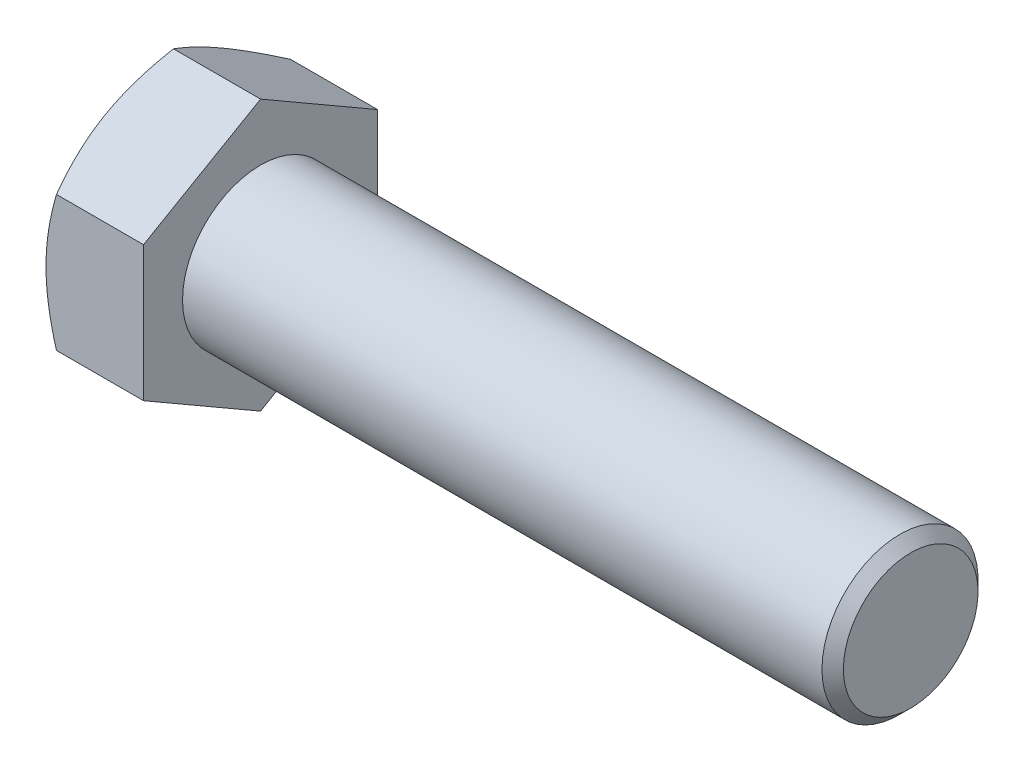
from build123d import *

# Parameters (mm, degrees)
BASEHEAD_DEPTH = 15


with BuildPart() as part:
    # BaseHeadSke → BaseHead (new body)
    with BuildSketch(Plane(origin=(0, 0, 0), x_dir=(0, 0, -1), z_dir=(1, 0, 0))):
        Polygon((0, 20.784609691), (-18, 10.392304845), (-18, -10.392304845), (0, -20.784609691), (18, -10.392304845), (18, 10.392304845), align=None)
    extrude(amount=BASEHEAD_DEPTH)

    # HeadChamferSke → HeadChamfer (revolve, cut)
    with BuildSketch(Plane.XY):
        Polygon((0, 20.784609691), (0, 18), (1.607695155, 20.784609691), align=None)
    revolve(axis=Axis((0, 0, 0), (1, 0, 0)), mode=Mode.SUBTRACT)

    # BodySke → BaseBody (revolve)
    with BuildSketch(Plane.XY):
        Polygon((0, 0), (115, 0), (115, 10.352), (113.352, 12), (0, 12), align=None)
    revolve(axis=Axis((0, 0, 0), (1, 0, 0)))


solid = part.part
